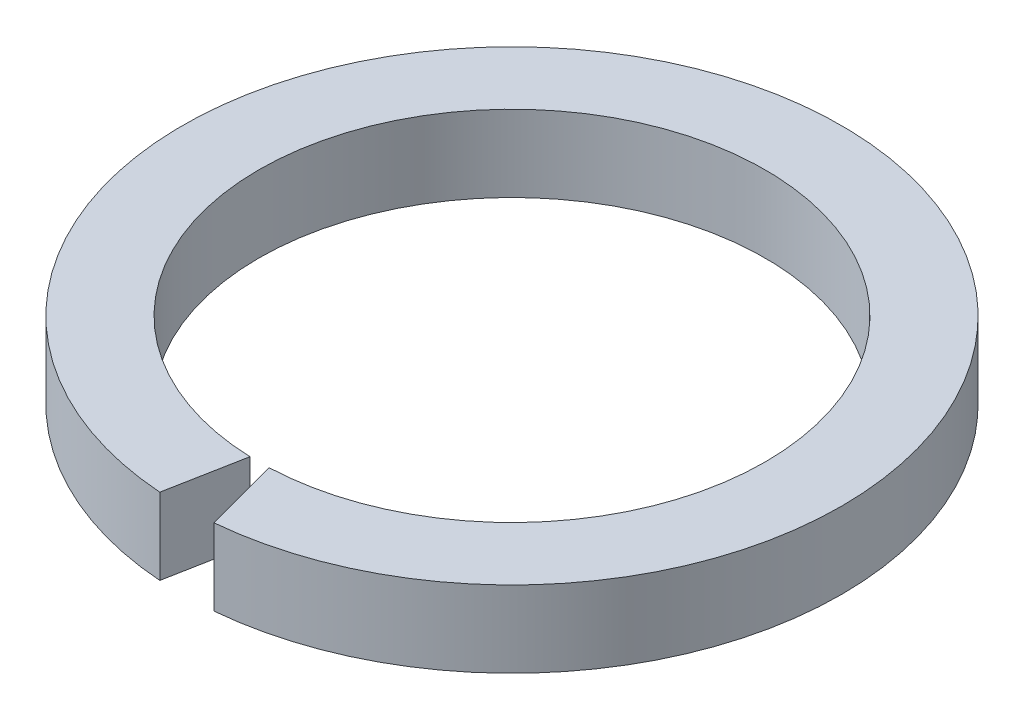
from build123d import *

# Parameters (mm, degrees)
SKETCH1_R               = 21.55
SKETCH1_R_2             = 16.55
BOSS_EXTRUDE1_DEPTH     = 5
CUT_EXTRUDE2_DEPTH      = 15
CUT_EXTRUDE2_DEPTH_BACK = 12


with BuildPart() as part:
    # Sketch1 → Boss-Extrude1 (new body)
    with BuildSketch(Plane(origin=(0, 0, 0), x_dir=(1, 0, 0), z_dir=(0, 1, 0))):
        Circle(SKETCH1_R)
        Circle(SKETCH1_R_2, mode=Mode.SUBTRACT)
    extrude(amount=BOSS_EXTRUDE1_DEPTH)

    # Sketch3 → Cut-Extrude2 (cut, two sides: drawn at the far end of the back side and taken through both)
    with BuildSketch(Plane(origin=(0, 0, 0), x_dir=(1, 0, 0), z_dir=(0, 1, 0)).offset(-CUT_EXTRUDE2_DEPTH_BACK)):
        Polygon((-1.758392575, -22.689237535), (2.305538937, -22.689237535), (0.504822735, -15.993131255), (0, -15.993131255), (-0.488859737, -15.993131255), align=None)
    extrude(amount=CUT_EXTRUDE2_DEPTH + CUT_EXTRUDE2_DEPTH_BACK, mode=Mode.SUBTRACT)


solid = part.part
